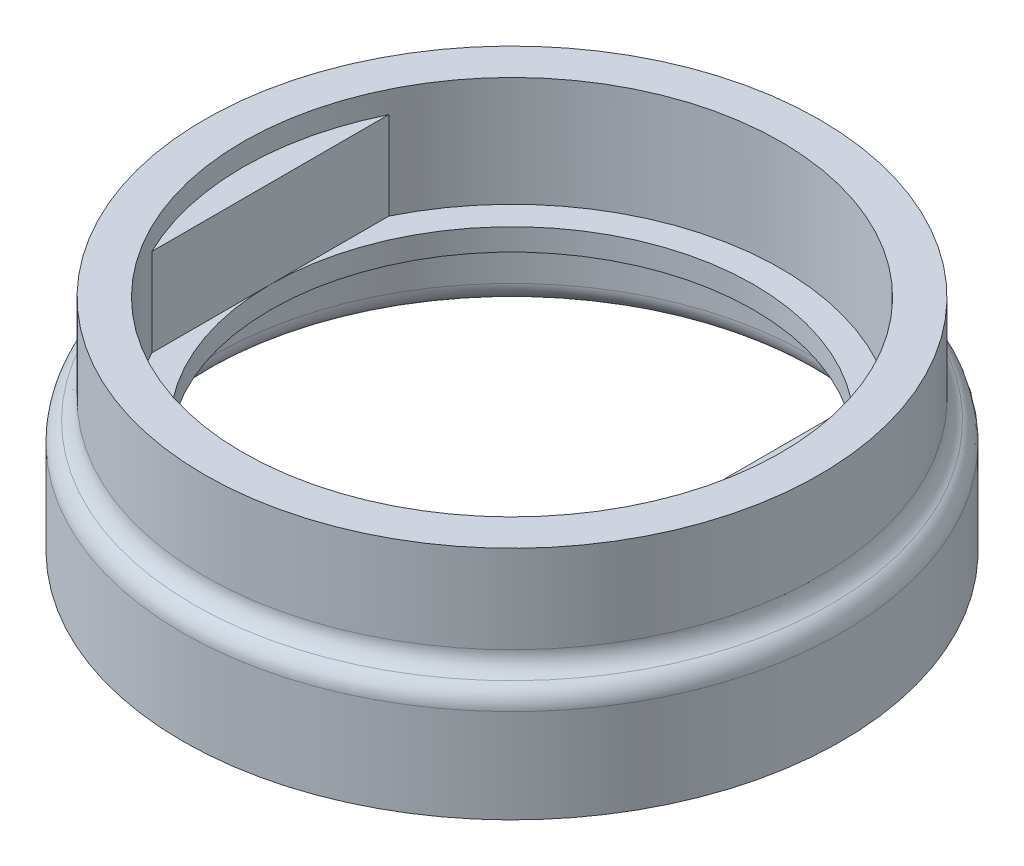
from build123d import *

# Parameters (mm, degrees)
SKETCH_1_R      = 14
SKETCH_1_R_2    = 12.25
EXTRUDE_1_DEPTH = 5
EXTRUDE_2_DEPTH = 4
SKETCH_3_R      = 15
SKETCH_3_R_2    = 13.5
EXTRUDE_3_DEPTH = 5
FILLET_2_R      = 1
FILLET_3_R      = 1
SKETCH_4_R      = 13.5
SKETCH_4_R_2    = 11
EXTRUDE_4_DEPTH = 1
FILLET_5_R      = 1


with BuildPart() as part:
    # 草图1 → 凸台-拉伸1 (new body)
    with BuildSketch(Plane(origin=(0, 0, 0), x_dir=(1, 0, 0), z_dir=(0, 1, 0))):
        with Locations(Location((0, 0, 0), (0, 0, 270))):
            Circle(SKETCH_1_R)
        with Locations(Location((0, 0, 0), (0, 0, 270))):
            Circle(SKETCH_1_R_2, mode=Mode.SUBTRACT)
    extrude(amount=EXTRUDE_1_DEPTH)

    # 草图2 → 凸台-拉伸2 (add)
    with BuildSketch(Plane(origin=(0, 0, 0), x_dir=(1, 0, 0), z_dir=(0, 1, 0))):
        with BuildLine():
            Line((-11, 5.390964663), (-11, -5.390964663))
            ThreePointArc((-11, -5.390964663), (-12.25, 0), (-11, 5.390964663))
        make_face()
        with BuildLine():
            Line((11, 5.390964663), (11, -5.390964663))
            ThreePointArc((11, -5.390964663), (12.25, 0), (11, 5.390964663))
        make_face()
    extrude(amount=EXTRUDE_2_DEPTH)

    # 草图3 → 凸台-拉伸3 (add)
    with BuildSketch(Plane(origin=(0, 0, 0), x_dir=(1, 0, 0), z_dir=(0, 1, 0))):
        with Locations(Location((0, 0, 0), (0, 0, 270))):
            Circle(SKETCH_3_R)
        with Locations(Location((0, 0, 0), (0, 0, 270))):
            Circle(SKETCH_3_R_2, mode=Mode.SUBTRACT)
    extrude(amount=-EXTRUDE_3_DEPTH)

    # 圆角2
    fillet_2_edges = [part.edges().sort_by_distance(p)[0] for p in [
        (0, 0, -14),
    ]]
    fillet(fillet_2_edges, radius=FILLET_2_R - 0.0001)  # a hair under: the kernel refuses the full size

    # 圆角3
    fillet_3_edges = [part.edges().sort_by_distance(p)[0] for p in [
        (0, 0, -15),
    ]]
    fillet(fillet_3_edges, radius=FILLET_3_R)

    # 草图4 → 凸台-拉伸4 (add)
    with BuildSketch(Plane.XZ):
        with Locations(Location((0, 0, 0), (0, 0, 90))):
            Circle(SKETCH_4_R)
        Circle(SKETCH_4_R_2, mode=Mode.SUBTRACT)
    extrude(amount=EXTRUDE_4_DEPTH)

    # 圆角5
    fillet_5_edges = [part.edges().sort_by_distance(p)[0] for p in [
        (0, -5, -13.5),
    ]]
    fillet(fillet_5_edges, radius=FILLET_5_R)


solid = part.part
